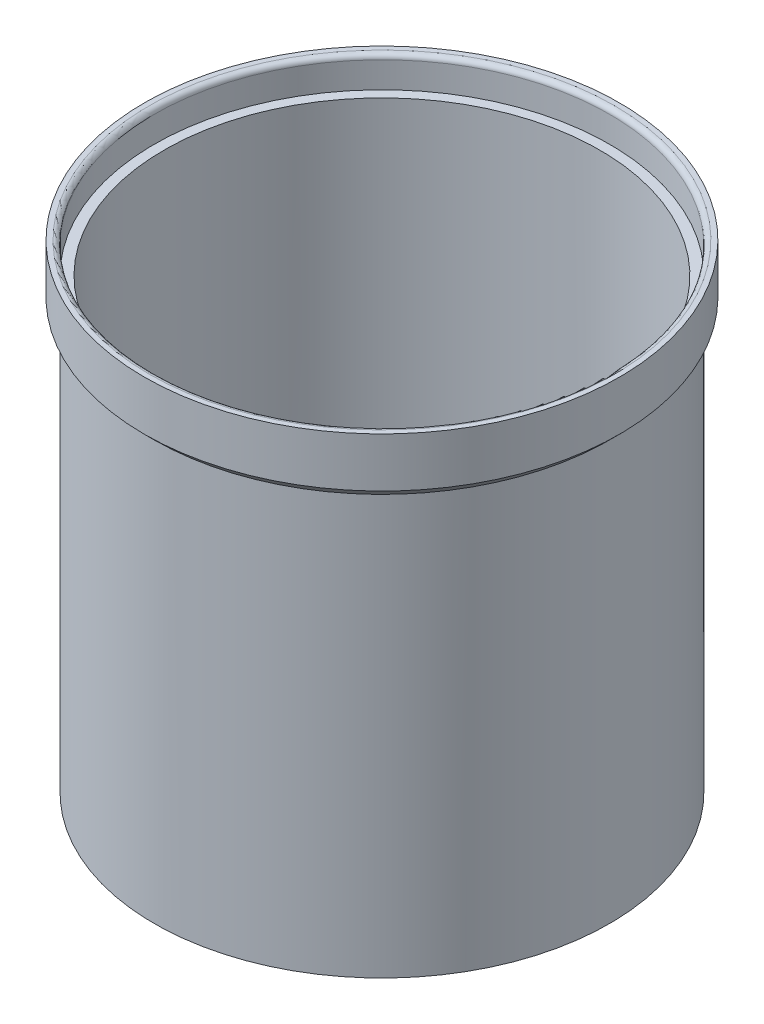
from build123d import *

# Parameters (mm, degrees)
SKETCH1_R                = 36.8
SKETCH1_R_2              = 35.2
BOSS_EXTRUDE1_DEPTH      = 70
BOSS_EXTRUDE2_DEPTH      = 5
BOSS_EXTRUDE2_DEPTH_BACK = 5
SKETCH2_R                = 38.4
SKETCH2_R_2              = 36.8
CHAMFER1_SIZE            = 2
FILLET1_R                = 0.8
BOSS_EXTRUDE3_START      = 2.3
SKETCH3_R                = 36.8
SKETCH3_R_2              = 36.2
BOSS_EXTRUDE3_DEPTH      = 2.3
CHAMFER2_SIZE            = 1
FILLET2_R                = 0.6


# Some blends are built 0.0001 mm under size
with BuildPart() as part:
    # Sketch1 → Boss-Extrude1 (new body)
    with BuildSketch(Plane(origin=(0, 0, 0), x_dir=(1, 0, 0), z_dir=(0, 1, 0))):
        with Locations(Location((0, 0, 0), (0, 0, 270))):
            Circle(SKETCH1_R)
        with Locations(Location((0, 0, 0), (0, 0, 270))):
            Circle(SKETCH1_R_2, mode=Mode.SUBTRACT)
    extrude(amount=BOSS_EXTRUDE1_DEPTH)

    # Sketch2 → Boss-Extrude2 (add, two sides: drawn at the far end of the back side and taken through both)
    with BuildSketch(Plane(origin=(0, 70, 0), x_dir=(1, 0, 0), z_dir=(0, 1, 0)).offset(-BOSS_EXTRUDE2_DEPTH_BACK)):
        with Locations(Location((0, 0, 0), (0, 0, 270))):
            Circle(SKETCH2_R)
        with Locations(Location((0, 0, 0), (0, 0, 270))):
            Circle(SKETCH2_R_2, mode=Mode.SUBTRACT)
    extrude(amount=BOSS_EXTRUDE2_DEPTH + BOSS_EXTRUDE2_DEPTH_BACK)

    # Chamfer1
    # the kernel refuses this chamfer: 2 mm, written as the material it takes off along each edge
    with BuildSketch(Plane(origin=(0, 65, 0), x_dir=(0, 0, 1), z_dir=(-1, 0, 0))) as chamfer1_piece_1_section:
        Polygon((38.4 - CHAMFER1_SIZE, 0), (38.4, CHAMFER1_SIZE), (38.4, 0), align=None)
    chamfer1_piece_1 = revolve(axis=Axis((0, 65, 0), (0, 1, 0)), mode=Mode.PRIVATE)
    chamfer1_piece_1 = chamfer1_piece_1 - Plane(origin=(0, 66.172330508, 0), x_dir=(0, 0, 1), z_dir=(0, -1, 0)) * Cylinder(36.8, 154, mode=Mode.PRIVATE)
    add(chamfer1_piece_1, mode=Mode.SUBTRACT)

    # Fillet1
    fillet1_edges = [part.edges().sort_by_distance(p)[0] for p in [
        (0, 75, -36.8),
    ]]
    fillet(fillet1_edges, radius=FILLET1_R)

    # Sketch3 → Boss-Extrude3 (add)
    with BuildSketch(Plane.XZ.offset(BOSS_EXTRUDE3_START)):
        with Locations(Location((0, 0, 0), (0, 0, 270))):
            Circle(SKETCH3_R)
        with Locations(Location((0, 0, 0), (0, 0, 270))):
            Circle(SKETCH3_R_2, mode=Mode.SUBTRACT)
    extrude(amount=-BOSS_EXTRUDE3_DEPTH)

    # Chamfer2
    chamfer2_edges = [part.edges().sort_by_distance(p)[0] for p in [
        (0, 0, -35.2),
    ]]
    chamfer(chamfer2_edges, length=CHAMFER2_SIZE - 0.0001)  # a hair under: the kernel refuses the full size

    # Fillet2
    fillet2_edges = [part.edges().sort_by_distance(p)[0] for p in [
        (0, -2.3, 36.2),
    ]]
    fillet(fillet2_edges, radius=FILLET2_R - 0.0001)  # a hair under: the kernel refuses the full size


solid = part.part
